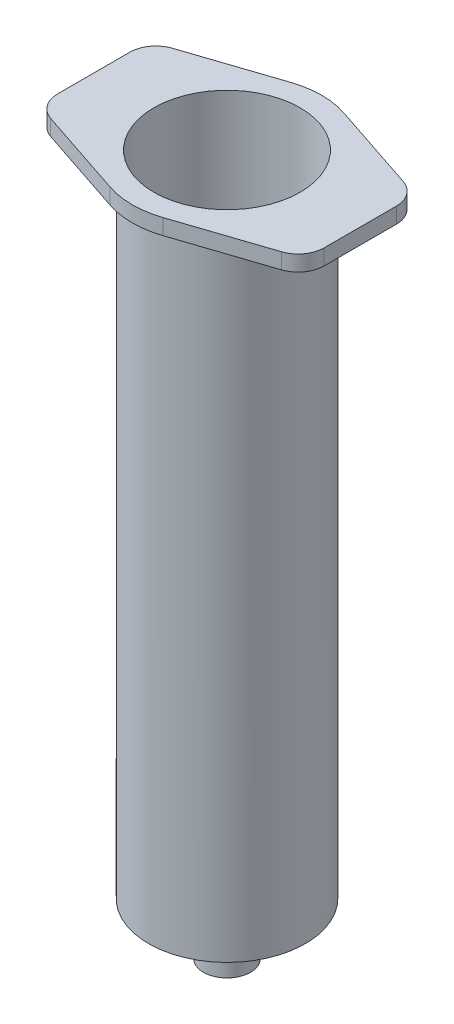
from build123d import *

# Parameters (mm, degrees)
SKIZZE1_R                       = 15
AUFSATZ_LINEAR_AUSTRAGEN1_DEPTH = 3
VERRUNDUNG1_R                   = 16
VERRUNDUNG2_R                   = 5


# Read off the part's stored shape, not the designer's step: Wandung1
with BuildPart() as part:
    # Skizze2 → Rotation1 (revolve)
    with BuildSketch(Plane.XY, mode=Mode.PRIVATE) as rotation1_sk:
        Polygon((0, -134), (4.5, -134), (4.5, -126), (15, -124), (15, 0), (0, 0), align=None)
    revolve(rotation1_sk.sketch.rotate(Axis((0, 0, 0), (0, -1, 0)), 180), axis=Axis((0, 0, 0), (0, -1, 0)))

    # Wandung1 outline → Wandung1 (revolve, cut)
    with BuildSketch(Plane.XY):
        Polygon((0, -134), (3.75, -134), (3.75, -125.124878175), (14, -123.172497223), (14, 0), (0, 0), align=None)
    revolve(axis=Axis((0, 0, 0), (0, 1, 0)), mode=Mode.SUBTRACT)

    # Skizze1 → Aufsatz-Linear austragen1 (add)
    with BuildSketch(Plane(origin=(0, 0, 0), x_dir=(1, 0, 0), z_dir=(0, 1, 0))):
        Polygon((0, -19), (25.5, -10.5), (25.5, 10.5), (0, 19), (-25.5, 10.5), (-25.5, -10.5), align=None)
        with Locations(Location((0, 0, 0), (0, 0, 180))):
            Circle(SKIZZE1_R, mode=Mode.SUBTRACT)
    extrude(amount=-AUFSATZ_LINEAR_AUSTRAGEN1_DEPTH)

    # Verrundung1
    verrundung1_edges = [part.edges().sort_by_distance(p)[0] for p in [
        (0, -1.5, 19),
        (0, -1.5, -19),
    ]]
    fillet(verrundung1_edges, radius=VERRUNDUNG1_R)

    # Verrundung2
    verrundung2_edges = [part.edges().sort_by_distance(p)[0] for p in [
        (-25.5, -1.5, 10.5),
        (-25.5, -1.5, -10.5),
        (25.5, -1.5, -10.5),
        (25.5, -1.5, 10.5),
    ]]
    fillet(verrundung2_edges, radius=VERRUNDUNG2_R)


solid = part.part
